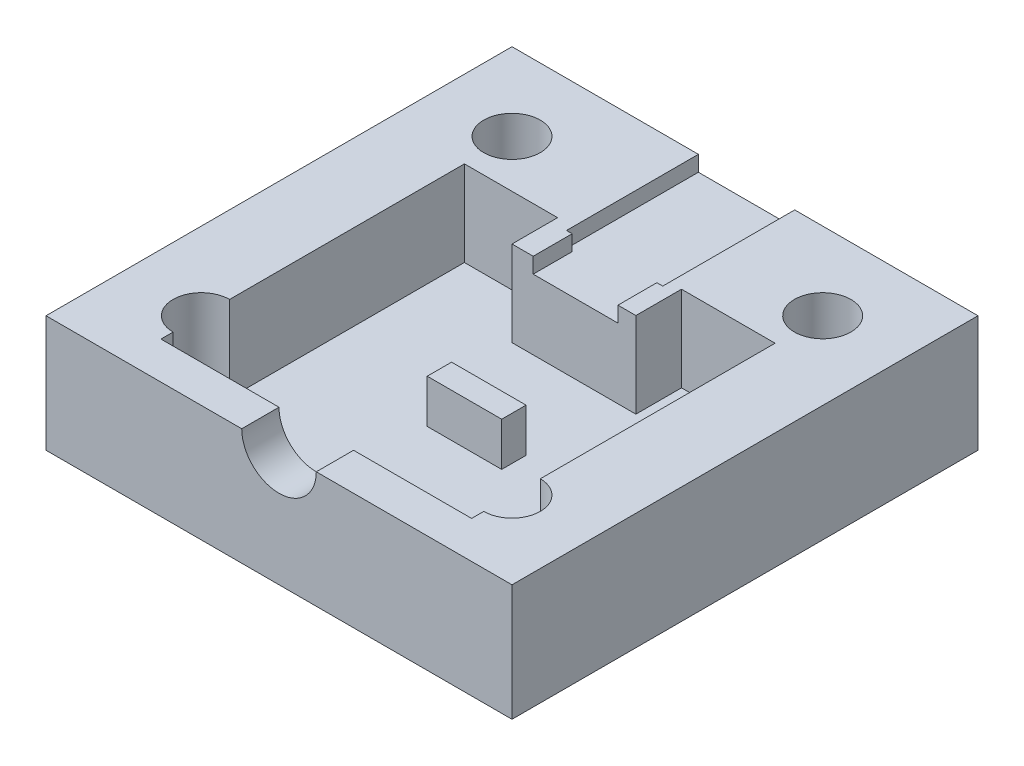
from build123d import *

# Parameters (mm, degrees)
SKETCH1_W           = 38.1
SKETCH1_H           = 38.1
BOSS_EXTRUDE2_DEPTH = 9.525
SKETCH5_W           = 25.4
SKETCH5_H           = 21.082
CUT_EXTRUDE2_DEPTH  = 6.985
SKETCH6_R           = 2.3114
CUT_EXTRUDE3_DEPTH  = 34.417
SKETCH7_W           = 7.874
SKETCH7_H           = 10.786013279
CUT_EXTRUDE4_DEPTH  = 1.27
SKETCH8_W           = 6.929300339
SKETCH8_H           = 3.183986721
CUT_EXTRUDE5_DEPTH  = 1.27
SKETCH9_R           = 3.048
CUT_EXTRUDE6_DEPTH  = 14.986
SKETCH10_W          = 7.62
SKETCH10_H          = 3.729426828
SKETCH10_W_2        = 7.651156175
CUT_EXTRUDE7_DEPTH  = 6.985
SKETCH11_W          = 6.08836009
SKETCH11_H          = 1.991786947
BOSS_EXTRUDE4_DEPTH = 3.556


with BuildPart() as part:
    # Sketch1 → Boss-Extrude2 (new body)
    with BuildSketch(Plane(origin=(0, 0, 0), x_dir=(1, 0, 0), z_dir=(0, 1, 0))):
        with Locations((31.75, 19.05)):
            Rectangle(SKETCH1_W, SKETCH1_H)
    extrude(amount=BOSS_EXTRUDE2_DEPTH)

    # Sketch5 → Cut-Extrude2 (cut)
    with BuildSketch(Plane(origin=(0, 9.525, 0), x_dir=(1, 0, 0), z_dir=(0, 1, 0))):
        with Locations((31.75, 13.589)):
            Rectangle(SKETCH5_W, SKETCH5_H)
    extrude(amount=-CUT_EXTRUDE2_DEPTH, mode=Mode.SUBTRACT)

    # Sketch6 → Cut-Extrude3 (cut)
    with BuildSketch(Plane(origin=(0, 9.525, 0), x_dir=(1, 0, 0), z_dir=(0, 1, 0))):
        with Locations((44.45, 31.75)):
            Circle(SKETCH6_R)
        with Locations((19.05, 31.75)):
            Circle(SKETCH6_R)
        with Locations((19.05, 6.35)):
            Circle(SKETCH6_R)
        with Locations((44.45, 6.35)):
            Circle(SKETCH6_R)
    extrude(amount=-CUT_EXTRUDE3_DEPTH, mode=Mode.SUBTRACT)

    # Sketch7 → Cut-Extrude4 (cut)
    with BuildSketch(Plane(origin=(0, 9.525, 0), x_dir=(1, 0, 0), z_dir=(0, 1, 0))):
        with Locations((31.877, 32.706993361)):
            Rectangle(SKETCH7_W, SKETCH7_H)
    extrude(amount=-CUT_EXTRUDE4_DEPTH, mode=Mode.SUBTRACT)

    # Sketch8 → Cut-Extrude5 (cut)
    with BuildSketch(Plane(origin=(0, 9.525, 0), x_dir=(1, 0, 0), z_dir=(0, 1, 0))):
        with Locations((31.867555607, 25.721993361)):
            Rectangle(SKETCH8_W, SKETCH8_H)
    extrude(amount=-CUT_EXTRUDE5_DEPTH, mode=Mode.SUBTRACT)

    # Sketch9 → Cut-Extrude6 (cut)
    with BuildSketch(Plane.XY):
        with Locations((31.75, 9.525)):
            Circle(SKETCH9_R)
    extrude(amount=-CUT_EXTRUDE6_DEPTH, mode=Mode.SUBTRACT)

    # Sketch10 → Cut-Extrude7 (cut)
    with BuildSketch(Plane(origin=(0, 9.525, 0), x_dir=(1, 0, 0), z_dir=(0, 1, 0))):
        with Locations((22.86, 25.994713414)):
            Rectangle(SKETCH10_W, SKETCH10_H)
        with Locations((40.624421913, 25.994713414)):
            Rectangle(SKETCH10_W_2, SKETCH10_H)
    extrude(amount=-CUT_EXTRUDE7_DEPTH, mode=Mode.SUBTRACT)

    # Sketch11 → Boss-Extrude4 (add)
    with BuildSketch(Plane(origin=(0, 2.54, 0), x_dir=(1, 0, 0), z_dir=(0, 1, 0))):
        with Locations((32.180780195, 15.727893473)):
            Rectangle(SKETCH11_W, SKETCH11_H)
    extrude(amount=BOSS_EXTRUDE4_DEPTH)


solid = part.part
